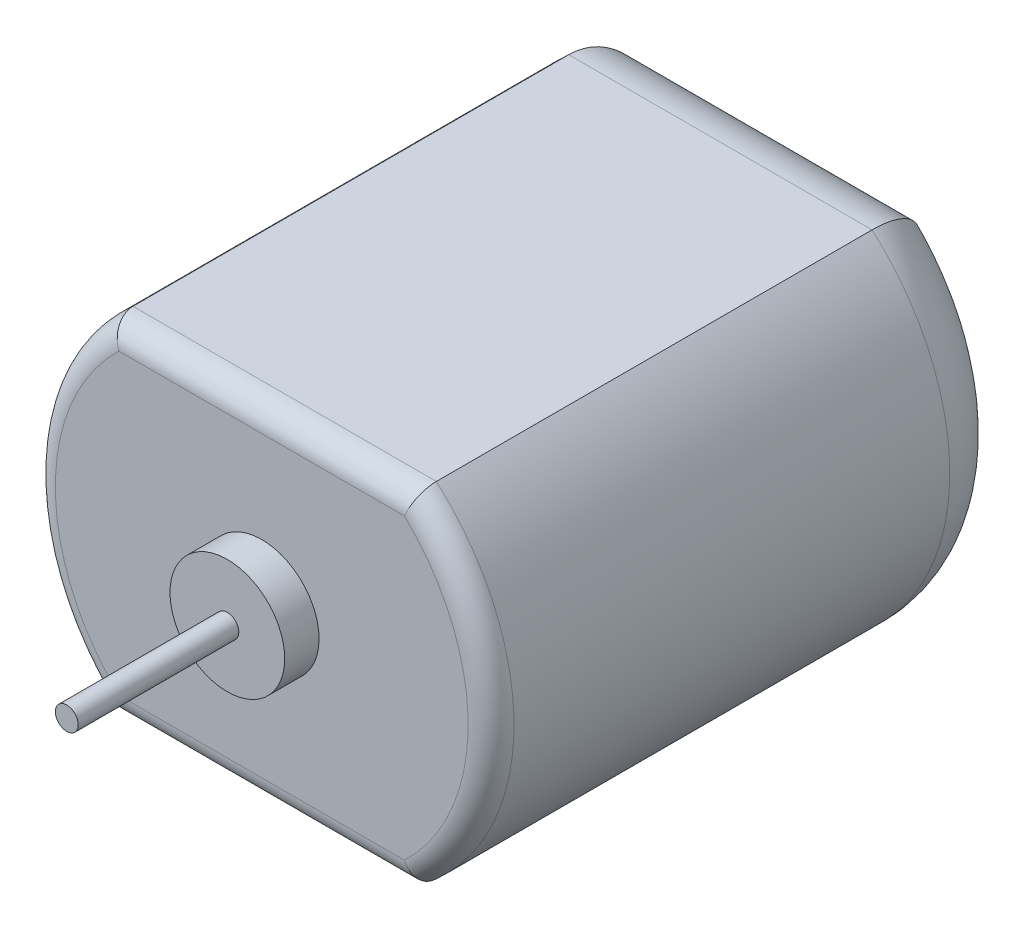
from build123d import *

# Parameters (mm, degrees)
BOSS_EXTRUDE1_DEPTH = 23
SKETCH2_R           = 2.5
BOSS_EXTRUDE2_DEPTH = 1.5
SKETCH3_R           = 0.5
BOSS_EXTRUDE3_DEPTH = 7
FILLET1_R           = 1
FILLET2_R           = 3
BOSS_EXTRUDE4_DEPTH = 1
FILLET3_R           = 0.5


with BuildPart() as part:
    # Sketch1 → Boss-Extrude1 (new body)
    with BuildSketch(Plane.XY):
        with BuildLine():
            Line((-6.614378278, 7.5), (6.614378278, 7.5))
            ThreePointArc((6.614378278, 7.5), (10, 0), (6.614378278, -7.5))
            Line((6.614378278, -7.5), (-6.614378278, -7.5))
            ThreePointArc((-6.614378278, -7.5), (-10, 0), (-6.614378278, 7.5))
        make_face()
    extrude(amount=BOSS_EXTRUDE1_DEPTH)

    # Sketch2 → Boss-Extrude2 (add)
    with BuildSketch(Plane.XY.offset(23)):
        Circle(SKETCH2_R)
    extrude(amount=BOSS_EXTRUDE2_DEPTH)

    # Sketch3 → Boss-Extrude3 (add)
    with BuildSketch(Plane.XY.offset(24.5)):
        Circle(SKETCH3_R)
    extrude(amount=BOSS_EXTRUDE3_DEPTH)

    # Fillet1
    fillet1_edges = [part.edges().sort_by_distance(p)[0] for p in [
        (10, 0, 23),
        (0, 7.5, 23),
        (-10, 0, 23),
        (0, -7.5, 23),
    ]]
    fillet(fillet1_edges, radius=FILLET1_R)

    # Fillet2
    # the kernel refuses this fillet: 3 mm, written as the material it takes off along each edge
    with BuildSketch(Plane(origin=(-14.114378278, 7.5, 0), x_dir=(0, 0, 1), z_dir=(1, 0, 0))) as fillet2_piece_1:
        with BuildLine():
            CenterArc((FILLET2_R, FILLET2_R), FILLET2_R, 180, 90)
            Line((0, FILLET2_R), (0, 0))
            Line((0, 0), (FILLET2_R, 0))
        make_face()
    extrude(amount=28.228756555, mode=Mode.SUBTRACT)
    with BuildSketch(Plane(origin=(0, 0, 0), x_dir=(-0.027613533277189895, 0.9996186736850955, 0), z_dir=(-0.9996186736850955, -0.027613533277189895, 0))) as fillet2_piece_2:
        with BuildLine():
            CenterArc((10 - FILLET2_R, -FILLET2_R), FILLET2_R, 0, 90)
            Line((10, -FILLET2_R), (10, 0))
            Line((10, 0), (10 - FILLET2_R, 0))
        make_face()
    revolve(axis=Axis((0, 0, 0), (0, 0, -1)), revolution_arc=183.164680097, mode=Mode.SUBTRACT)
    with BuildSketch(Plane(origin=(14.114378278, -7.5, 0), x_dir=(0, 1, 0), z_dir=(-1, 0, 0))) as fillet2_piece_3:
        with BuildLine():
            CenterArc((FILLET2_R, -FILLET2_R), FILLET2_R, 90, 90)
            Line((0, -FILLET2_R), (0, 0))
            Line((0, 0), (FILLET2_R, 0))
        make_face()
    extrude(amount=28.228756555, mode=Mode.SUBTRACT)
    with BuildSketch(Plane(origin=(0, 0, 0), x_dir=(0.02761353327718998, -0.9996186736850955, 0), z_dir=(0.9996186736850955, 0.02761353327718998, 0))) as fillet2_piece_4:
        with BuildLine():
            CenterArc((10 - FILLET2_R, -FILLET2_R), FILLET2_R, 0, 90)
            Line((10 - FILLET2_R, 0), (10, 0))
            Line((10, 0), (10, -FILLET2_R))
        make_face()
    revolve(axis=Axis((0, 0, 0), (0, 0, -1)), revolution_arc=183.164680097, mode=Mode.SUBTRACT)

    # Sketch4 → Boss-Extrude4 (add)
    with BuildSketch(Plane(origin=(0, 0, 0), x_dir=(-1, 0, 0), z_dir=(0, 0, -1))):
        with BuildLine():
            Line((-2.758585466, 1.606625472), (2.758585466, 1.606625472))
            ThreePointArc((2.758585466, 1.606625472), (0, -3.192340705), (-2.758585466, 1.606625472))
        make_face()
    extrude(amount=BOSS_EXTRUDE4_DEPTH)

    # Fillet3
    fillet3_edges = [part.edges().sort_by_distance(p)[0] for p in [
        (0, -3.192340705, -1),
        (0, 1.606625472, -1),
    ]]
    fillet(fillet3_edges, radius=FILLET3_R)


solid = part.part
